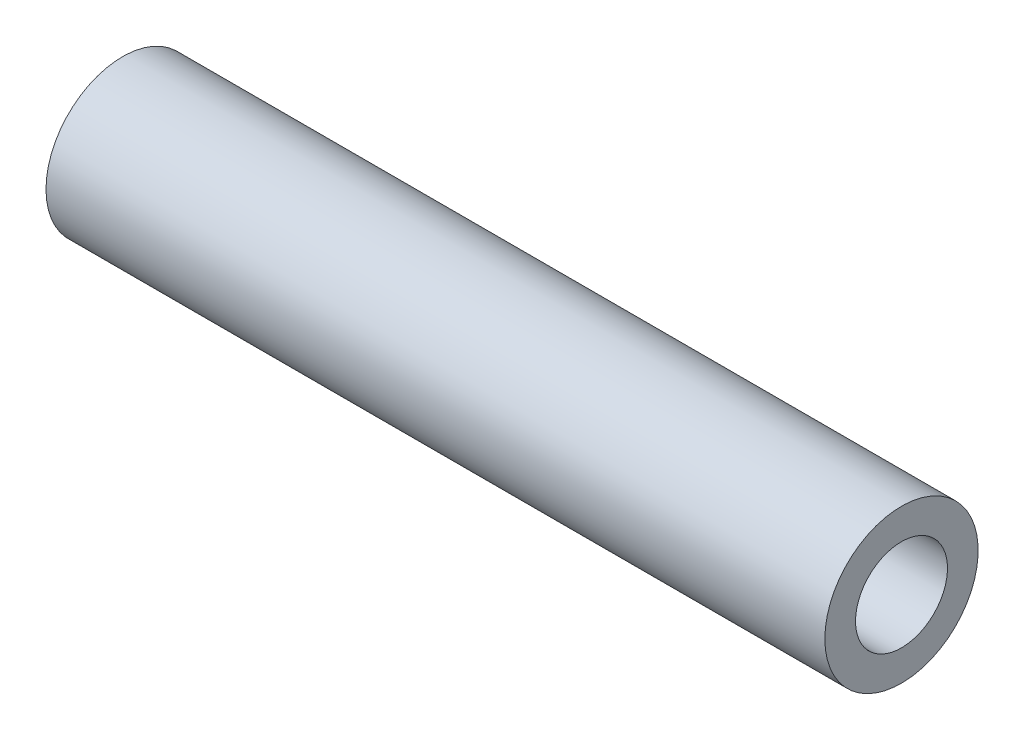
from build123d import *


with BuildPart() as part:
    # Sketch2 → Revolve1 (revolve)
    with BuildSketch(Plane(origin=(0, 0, 0), x_dir=(1, 0, 0), z_dir=(0, 1, 0))):
        Polygon((0, 5.000000033), (40.8, 5.000000033), (40.8, 6), (50.8, 6), (50.8, 9.999999939), (0, 9.999999939), align=None)
    revolve1 = revolve(axis=Axis((0, 0, 0), (1, 0, 0)))

    # Mirror1: Revolve1 across plane
    add(revolve1.mirror(Plane(origin=(0, 0, -9.999999939), x_dir=(0, 0, 1), z_dir=(1, 0, 0))))


solid = part.part
